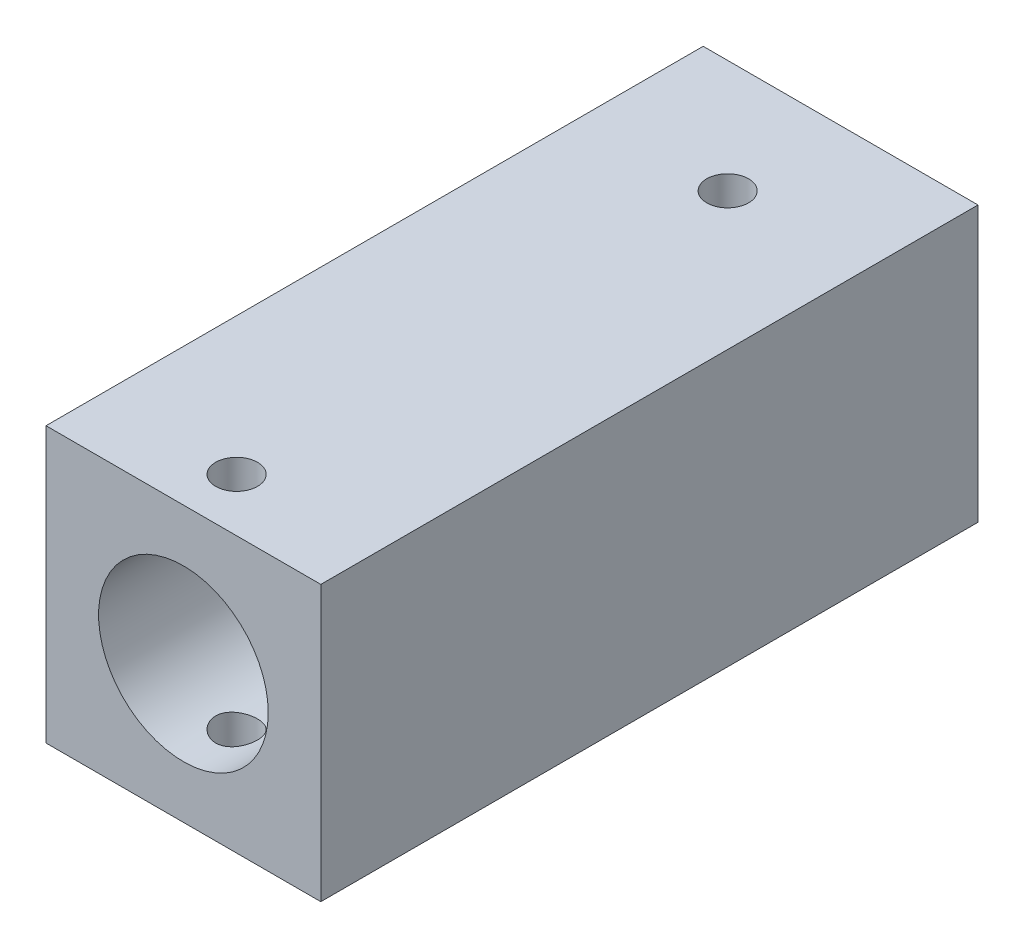
from build123d import *

# Parameters (mm, degrees)
SCHIZZO1_W                   = 23
SCHIZZO1_H                   = 23
ESTRUSIONE_ESTRUSIONE1_DEPTH = 55
TAGLIO_ESTRUSIONE12_REACH    = 60.671
SCHIZZO18_R                  = 7.1
SMUSSO4_SIZE                 = 1
SMUSSO4_SIZE2                = 3
SCHIZZO19_R                  = 1.75
TAGLIO_ESTRUSIONE13_DEPTH    = 62.486055435


with BuildPart() as part:
    # Schizzo1 → Estrusione-Estrusione1 (new body)
    with BuildSketch(Plane.XY):
        with Locations((-3.551080126, 2.313028552)):
            Rectangle(SCHIZZO1_W, SCHIZZO1_H)
    extrude(amount=ESTRUSIONE_ESTRUSIONE1_DEPTH)

    # Schizzo18 → Taglio-Estrusione12 (cut, up to next)
    with BuildSketch(Plane(origin=(0, 0, 0), x_dir=(-1, 0, 0), z_dir=(0, 0, -1)), mode=Mode.PRIVATE) as taglio_estrusione12_sk1:
        with Locations((3.551080126, 2.313028552)):
            Circle(SCHIZZO18_R)
    taglio_estrusione12_tool1 = extrude(taglio_estrusione12_sk1.sketch, amount=-TAGLIO_ESTRUSIONE12_REACH, mode=Mode.PRIVATE) & part.part
    add(taglio_estrusione12_tool1.solids().sort_by_distance((-3.55108, 2.313029, 0))[0], mode=Mode.SUBTRACT)

    # Smusso4
    smusso4_edges = [part.edges().sort_by_distance(p)[0] for p in [
        (3.548919874, 2.313028552, 0),
    ]]
    smusso4_side = [part.faces().sort_by_distance(p)[0] for p in [
        (-3.551080126, -8.861702329, 0),
    ]]
    chamfer(smusso4_edges, length=SMUSSO4_SIZE, length2=SMUSSO4_SIZE2, reference=smusso4_side[0])

    # Schizzo19 → Taglio-Estrusione13 (cut, through all)
    with BuildSketch(Plane(origin=(0, 13.813028552, 0), x_dir=(1, 0, 0), z_dir=(0, 1, 0))):
        with Locations((-3.551080126, -50.55)):
            Circle(SCHIZZO19_R)
        with Locations((-3.551080126, -9.45)):
            Circle(SCHIZZO19_R)
    extrude(amount=-TAGLIO_ESTRUSIONE13_DEPTH, mode=Mode.SUBTRACT)


solid = part.part
